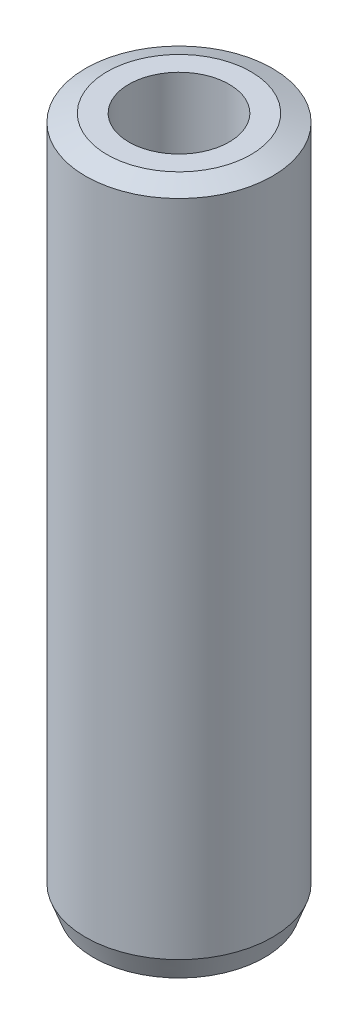
from build123d import *
from OCP.BRepFilletAPI import BRepFilletAPI_MakeChamfer

# Parameters (mm, degrees)
SKETCH1_R           = 25
BOSS_EXTRUDE1_DEPTH = 184.246852804
SKETCH2_R           = 13.415118503
CUT_EXTRUDE1_DEPTH  = 188.608376061
CHAMFER1_SIZE       = 2.1150276
CHAMFER1_SIZE2      = 5.751365602


with BuildPart() as part:
    # Sketch1 → Boss-Extrude1 (new body)
    with BuildSketch(Plane(origin=(0, 0, 0), x_dir=(1, 0, 0), z_dir=(0, 1, 0))):
        Circle(SKETCH1_R)
    extrude(amount=BOSS_EXTRUDE1_DEPTH)

    # Sketch2 → Cut-Extrude1 (cut, through all)
    with BuildSketch(Plane(origin=(0, 0, 0), x_dir=(1, 0, 0), z_dir=(0, 1, 0))):
        Circle(SKETCH2_R)
    extrude(amount=CUT_EXTRUDE1_DEPTH, mode=Mode.SUBTRACT)

    # Chamfer1: one chamfer whose edges measure the first distance from different faces: ONE call of the kernel's chamfer builder (chamfer() names one face for all edges)
    chamfer1_edges_1 = [part.edges().sort_by_distance(p)[0] for p in [
        (-25, 184.246852804, 0),
    ]]
    chamfer1_side_1 = [part.faces().sort_by_distance(p)[0] for p in [
        (-25, 92.123426402, 0),
    ]]
    chamfer1_edges_2 = [part.edges().sort_by_distance(p)[0] for p in [
        (-25, 0, 0),
    ]]
    chamfer1_side_2 = [part.faces().sort_by_distance(p)[0] for p in [
        (-24.292893219, 0, 0),
    ]]
    chamfer1 = BRepFilletAPI_MakeChamfer(part.part.solid().wrapped)
    for e in chamfer1_edges_1:
        chamfer1.Add(CHAMFER1_SIZE, CHAMFER1_SIZE2, e.wrapped, chamfer1_side_1[0].wrapped)  # the first distance lies on this face
    for e in chamfer1_edges_2:
        chamfer1.Add(CHAMFER1_SIZE, CHAMFER1_SIZE2, e.wrapped, chamfer1_side_2[0].wrapped)  # the first distance lies on this face
    add(Compound.cast(chamfer1.Shape()), mode=Mode.REPLACE)


solid = part.part
